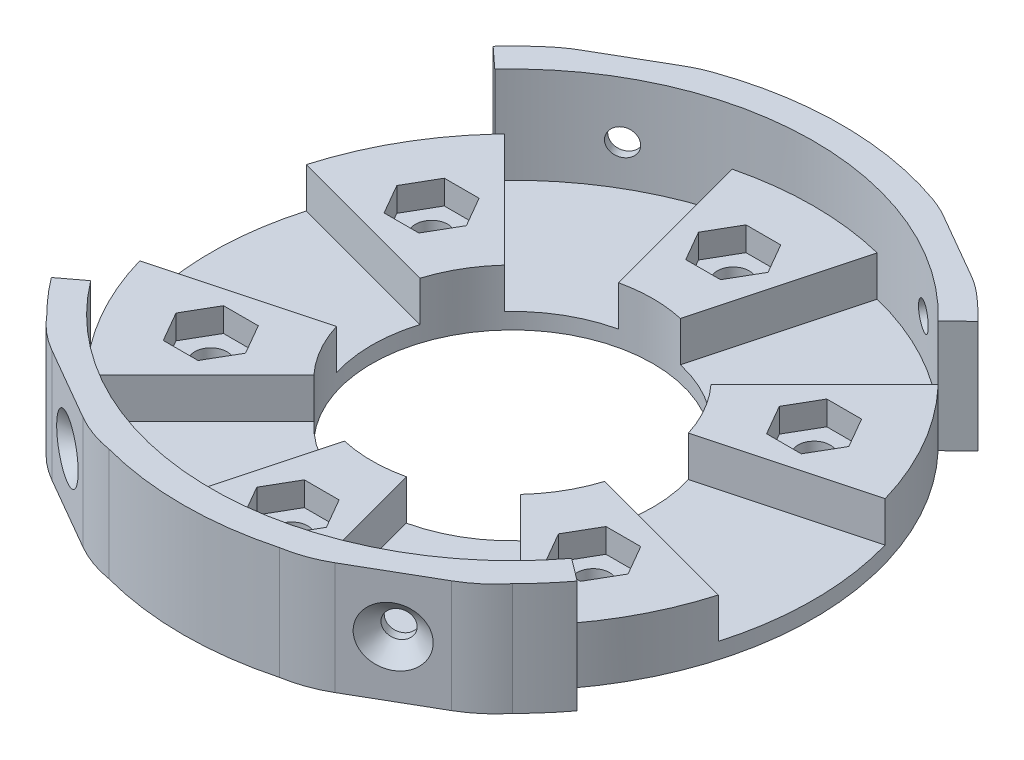
from build123d import *
from build123d.topology import SkipClean

# Parameters (mm, degrees)
BOSS_EXTRUDE2_DEPTH = 3
BOSS_EXTRUDE3_START = 2
SKETCH2_R           = 2
BOSS_EXTRUDE3_DEPTH = 2
BOSS_EXTRUDE4_START = 2
SKETCH3_R           = 37.5
SKETCH3_R_2         = 17.5
SKETCH3_R_3         = 2
BOSS_EXTRUDE4_DEPTH = 2
BOSS_EXTRUDE5_DEPTH = 14
FILLET1_R           = 15
CUT_EXTRUDE1_DEPTH  = 85
CUT_EXTRUDE2_DEPTH  = 85
CHAMFER2_SIZE       = 2


with BuildPart() as part:
    # Sketch1 → Boss-Extrude2 (new body)
    # profile 1 of 9: a face of its own
    with BuildSketch(Plane(origin=(0, 0, 0), x_dir=(1, 0, 0), z_dir=(0, 1, 0))):
        with BuildLine():
            ThreePointArc((-3.849560294, 17.071346917), (-1.936676142, 17.392506591), (0, 17.5))
            Line((0, 17.5), (0, 23.75))
            Line((0, 23.75), (-2.165063509, 23.75))
            Line((-2.165063509, 23.75), (-4.330127019, 27.5))
            Line((-4.330127019, 27.5), (-2.165063509, 31.25))
            Line((-2.165063509, 31.25), (0, 31.25))
            Line((0, 31.25), (0, 37.5))
            ThreePointArc((0, 37.5), (-4.547498174, 37.223248923), (-9.027875015, 36.397080552))
            Line((-9.027875015, 36.397080552), (-3.849560294, 17.071346917))
        make_face()
    # profile 2 of 9: a face of its own
    with BuildSketch(Plane(origin=(0, 0, 0), x_dir=(1, 0, 0), z_dir=(0, 1, 0))):
        with BuildLine():
            Line((3.849560294, 17.071346917), (9.027875015, 36.397080552))
            ThreePointArc((9.027875015, 36.397080552), (4.547498174, 37.223248923), (0, 37.5))
            Line((0, 37.5), (0, 31.25))
            Line((0, 31.25), (2.165063509, 31.25))
            Line((2.165063509, 31.25), (4.330127019, 27.5))
            Line((4.330127019, 27.5), (2.165063509, 23.75))
            Line((2.165063509, 23.75), (0, 23.75))
            Line((0, 23.75), (0, 17.5))
            ThreePointArc((0, 17.5), (1.936676142, 17.392506591), (3.849560294, 17.071346917))
        make_face()
    # profile 3 of 9: a face of its own
    with BuildSketch(Plane(origin=(0, 0, 0), x_dir=(1, 0, 0), z_dir=(0, 1, 0))):
        with BuildLine():
            Line((-36.034733889, 10.380171171), (-16.709000253, 5.201856451))
            ThreePointArc((-16.709000253, 5.201856451), (-15.155444566, 8.75), (-12.85943996, 11.869490466))
            Line((-12.85943996, 11.869490466), (-27.006858875, 26.016909381))
            ThreePointArc((-27.006858875, 26.016909381), (-32.475952642, 18.75), (-36.034733889, 10.380171171))
        make_face()
        Polygon((-21.650635095, 10), (-25.980762114, 10), (-28.145825623, 13.75), (-25.980762114, 17.5), (-21.650635095, 17.5), (-19.485571585, 13.75), align=None, mode=Mode.SUBTRACT)
    # profile 4 of 9: a face of its own
    with BuildSketch(Plane(origin=(0, 0, 0), x_dir=(1, 0, 0), z_dir=(0, 1, 0))):
        with BuildLine():
            Line((19.485571585, 13.75), (21.650635095, 17.5))
            Line((21.650635095, 17.5), (24.609026292, 17.5))
            Line((24.609026292, 17.5), (26.250883265, 25.260933771))
            Line((26.250883265, 25.260933771), (12.85943996, 11.869490466))
            ThreePointArc((12.85943996, 11.869490466), (14.094014472, 10.373464034), (15.155444566, 8.75))
            Line((15.155444566, 8.75), (20.56810334, 11.875))
            Line((20.56810334, 11.875), (19.485571585, 13.75))
        make_face()
    # profile 5 of 9: a face of its own
    with BuildSketch(Plane(origin=(0, 0, 0), x_dir=(1, 0, 0), z_dir=(0, 1, 0))):
        with BuildLine():
            Line((21.650635095, 10), (20.56810334, 11.875))
            Line((20.56810334, 11.875), (15.155444566, 8.75))
            ThreePointArc((15.155444566, 8.75), (16.030690615, 7.019042557), (16.709000253, 5.201856451))
            Line((16.709000253, 5.201856451), (36.034733889, 10.380171171))
            ThreePointArc((36.034733889, 10.380171171), (34.510028266, 14.673375519), (32.475952642, 18.75))
            Line((32.475952642, 18.75), (27.063293868, 15.625))
            Line((27.063293868, 15.625), (28.145825623, 13.75))
            Line((28.145825623, 13.75), (25.980762114, 10))
            Line((25.980762114, 10), (21.650635095, 10))
        make_face()
    # profile 6 of 9: a face of its own
    with BuildSketch(Plane(origin=(0, 0, 0), x_dir=(1, 0, 0), z_dir=(0, 1, 0))):
        with BuildLine():
            Line((26.250883265, 25.260933771), (24.609026292, 17.5))
            Line((24.609026292, 17.5), (25.980762114, 17.5))
            Line((25.980762114, 17.5), (27.063293868, 15.625))
            Line((27.063293868, 15.625), (32.475952642, 18.75))
            ThreePointArc((32.475952642, 18.75), (29.962530091, 22.549873404), (27.006858875, 26.016909381))
            Line((27.006858875, 26.016909381), (26.250883265, 25.260933771))
        make_face()
    # profile 7 of 9: a face of its own
    with BuildSketch(Plane(origin=(0, 0, 0), x_dir=(1, 0, 0), z_dir=(0, 1, 0))):
        with BuildLine():
            Line((36.034733889, -10.380171171), (16.709000253, -5.201856451))
            ThreePointArc((16.709000253, -5.201856451), (15.155444566, -8.75), (12.85943996, -11.869490466))
            Line((12.85943996, -11.869490466), (27.006858875, -26.016909381))
            ThreePointArc((27.006858875, -26.016909381), (32.475952642, -18.75), (36.034733889, -10.380171171))
        make_face()
        Polygon((21.650635095, -10), (25.980762114, -10), (28.145825623, -13.75), (25.980762114, -17.5), (21.650635095, -17.5), (19.485571585, -13.75), align=None, mode=Mode.SUBTRACT)
    # profile 8 of 9: a face of its own
    with BuildSketch(Plane(origin=(0, 0, 0), x_dir=(1, 0, 0), z_dir=(0, 1, 0))):
        with BuildLine():
            Line((9.027875015, -36.397080552), (3.849560294, -17.071346917))
            ThreePointArc((3.849560294, -17.071346917), (0, -17.5), (-3.849560294, -17.071346917))
            Line((-3.849560294, -17.071346917), (-9.027875015, -36.397080552))
            ThreePointArc((-9.027875015, -36.397080552), (0, -37.5), (9.027875015, -36.397080552))
        make_face()
        Polygon((2.165063509, -23.75), (4.330127019, -27.5), (2.165063509, -31.25), (-2.165063509, -31.25), (-4.330127019, -27.5), (-2.165063509, -23.75), align=None, mode=Mode.SUBTRACT)
    # profile 9 of 9: a face of its own
    with BuildSketch(Plane(origin=(0, 0, 0), x_dir=(1, 0, 0), z_dir=(0, 1, 0))):
        with BuildLine():
            Line((-27.006858875, -26.016909381), (-12.85943996, -11.869490466))
            ThreePointArc((-12.85943996, -11.869490466), (-15.155444566, -8.75), (-16.709000253, -5.201856451))
            Line((-16.709000253, -5.201856451), (-36.034733889, -10.380171171))
            ThreePointArc((-36.034733889, -10.380171171), (-32.475952642, -18.75), (-27.006858875, -26.016909381))
        make_face()
        Polygon((-19.485571585, -13.75), (-21.650635095, -17.5), (-25.980762114, -17.5), (-28.145825623, -13.75), (-25.980762114, -10), (-21.650635095, -10), align=None, mode=Mode.SUBTRACT)
    extrude(amount=BOSS_EXTRUDE2_DEPTH)

    # Sketch2 → Boss-Extrude3 (add)
    # profile 1 of 6: a face of its own
    with BuildSketch(Plane(origin=(0, 0, 0), x_dir=(-1, 0, 0), z_dir=(0, -1, 0)).offset(BOSS_EXTRUDE3_START)):
        with BuildLine():
            ThreePointArc((12.85943996, 11.869490466), (15.155444566, 8.75), (16.709000253, 5.201856451))
            Line((16.709000253, 5.201856451), (36.034733889, 10.380171171))
            ThreePointArc((36.034733889, 10.380171171), (32.475952642, 18.75), (27.006858875, 26.016909381))
            Line((27.006858875, 26.016909381), (12.85943996, 11.869490466))
        make_face()
        with Locations(Location((23.815698604, 13.75, 0), (0, 0, 90))):
            Circle(SKETCH2_R, mode=Mode.SUBTRACT)
    # profile 2 of 6: a face of its own
    with BuildSketch(Plane(origin=(0, 0, 0), x_dir=(-1, 0, 0), z_dir=(0, -1, 0)).offset(BOSS_EXTRUDE3_START)):
        with BuildLine():
            Line((36.034733889, -10.380171171), (16.709000253, -5.201856451))
            ThreePointArc((16.709000253, -5.201856451), (15.155444566, -8.75), (12.85943996, -11.869490466))
            Line((12.85943996, -11.869490466), (27.006858875, -26.016909381))
            ThreePointArc((27.006858875, -26.016909381), (32.475952642, -18.75), (36.034733889, -10.380171171))
        make_face()
        with Locations(Location((23.815698604, -13.75, 0), (0, 0, 90))):
            Circle(SKETCH2_R, mode=Mode.SUBTRACT)
    # profile 3 of 6: a face of its own
    with BuildSketch(Plane(origin=(0, 0, 0), x_dir=(-1, 0, 0), z_dir=(0, -1, 0)).offset(BOSS_EXTRUDE3_START)):
        with BuildLine():
            ThreePointArc((-3.849560294, 17.071346917), (0, 17.5), (3.849560294, 17.071346917))
            Line((3.849560294, 17.071346917), (9.027875015, 36.397080552))
            ThreePointArc((9.027875015, 36.397080552), (0, 37.5), (-9.027875015, 36.397080552))
            Line((-9.027875015, 36.397080552), (-3.849560294, 17.071346917))
        make_face()
        with Locations(Location((0, 27.5, 0), (0, 0, 90))):
            Circle(SKETCH2_R, mode=Mode.SUBTRACT)
    # profile 4 of 6: a face of its own
    with BuildSketch(Plane(origin=(0, 0, 0), x_dir=(-1, 0, 0), z_dir=(0, -1, 0)).offset(BOSS_EXTRUDE3_START)):
        with BuildLine():
            Line((9.027875015, -36.397080552), (3.849560294, -17.071346917))
            ThreePointArc((3.849560294, -17.071346917), (0, -17.5), (-3.849560294, -17.071346917))
            Line((-3.849560294, -17.071346917), (-9.027875015, -36.397080552))
            ThreePointArc((-9.027875015, -36.397080552), (0, -37.5), (9.027875015, -36.397080552))
        make_face()
        with Locations(Location((0, -27.5, 0), (0, 0, 90))):
            Circle(SKETCH2_R, mode=Mode.SUBTRACT)
    # profile 5 of 6: a face of its own
    with BuildSketch(Plane(origin=(0, 0, 0), x_dir=(-1, 0, 0), z_dir=(0, -1, 0)).offset(BOSS_EXTRUDE3_START)):
        with BuildLine():
            ThreePointArc((-16.709000253, 5.201856451), (-15.155444566, 8.75), (-12.85943996, 11.869490466))
            Line((-12.85943996, 11.869490466), (-27.006858875, 26.016909381))
            ThreePointArc((-27.006858875, 26.016909381), (-32.475952642, 18.75), (-36.034733889, 10.380171171))
            Line((-36.034733889, 10.380171171), (-16.709000253, 5.201856451))
        make_face()
        with Locations(Location((-23.815698604, 13.75, 0), (0, 0, 90))):
            Circle(SKETCH2_R, mode=Mode.SUBTRACT)
    # profile 6 of 6: a face of its own
    with BuildSketch(Plane(origin=(0, 0, 0), x_dir=(-1, 0, 0), z_dir=(0, -1, 0)).offset(BOSS_EXTRUDE3_START)):
        with BuildLine():
            Line((-27.006858875, -26.016909381), (-12.85943996, -11.869490466))
            ThreePointArc((-12.85943996, -11.869490466), (-15.155444566, -8.75), (-16.709000253, -5.201856451))
            Line((-16.709000253, -5.201856451), (-36.034733889, -10.380171171))
            ThreePointArc((-36.034733889, -10.380171171), (-32.475952642, -18.75), (-27.006858875, -26.016909381))
        make_face()
        with Locations(Location((-23.815698604, -13.75, 0), (0, 0, 90))):
            Circle(SKETCH2_R, mode=Mode.SUBTRACT)
    extrude(amount=-BOSS_EXTRUDE3_DEPTH)

    # Sketch3 → Boss-Extrude4 (add)
    with BuildSketch(Plane(origin=(0, -2, 0), x_dir=(-1, 0, 0), z_dir=(0, -1, 0)).offset(BOSS_EXTRUDE4_START)):
        with Locations(Location((0, 0, 0), (0, 0, 90))):
            Circle(SKETCH3_R)
        with Locations(Location((0, 0, 0), (0, 0, 90))):
            Circle(SKETCH3_R_2, mode=Mode.SUBTRACT)
        with Locations(Location((0, 27.5, 0), (0, 0, 90))):
            Circle(SKETCH3_R_3, mode=Mode.SUBTRACT)
        with Locations(Location((23.815698604, 13.75, 0), (0, 0, 90))):
            Circle(SKETCH3_R_3, mode=Mode.SUBTRACT)
        with Locations(Location((23.815698604, -13.75, 0), (0, 0, 90))):
            Circle(SKETCH3_R_3, mode=Mode.SUBTRACT)
        with Locations(Location((0, -27.5, 0), (0, 0, 90))):
            Circle(SKETCH3_R_3, mode=Mode.SUBTRACT)
        with Locations(Location((-23.815698604, -13.75, 0), (0, 0, 90))):
            Circle(SKETCH3_R_3, mode=Mode.SUBTRACT)
        with Locations(Location((-23.815698604, 13.75, 0), (0, 0, 90))):
            Circle(SKETCH3_R_3, mode=Mode.SUBTRACT)
    extrude(amount=-BOSS_EXTRUDE4_DEPTH)

    # Sketch4 → Boss-Extrude5 (add)
    with SkipClean():  # the faces are left unmerged after this step: merging them gives an invalid solid
        with BuildSketch(Plane(origin=(0, -4, 0), x_dir=(-1, 0, 0), z_dir=(0, -1, 0))):
            with BuildLine():
                Line((32.740350171, -24.679332865), (29.94544223, -22.572560548))
                ThreePointArc((29.94544223, -22.572560548), (0, -37.5), (-29.94544223, -22.572560548))
                Line((-29.94544223, -22.572560548), (-32.740350171, -24.679332865))
                ThreePointArc((-32.740350171, -24.679332865), (-30.941073026, -26.900743484), (-28.991378029, -28.991378029))
                Line((-28.991378029, -28.991378029), (-29.69848481, -29.69848481))
                Line((-29.69848481, -29.69848481), (-10.870399894, -40.568884704))
                Line((-10.870399894, -40.568884704), (-10.611580849, -39.602958878))
                ThreePointArc((-10.611580849, -39.602958878), (0, -41), (10.611580849, -39.602958878))
                Line((10.611580849, -39.602958878), (10.870399894, -40.568884704))
                Line((10.870399894, -40.568884704), (29.69848481, -29.69848481))
                Line((29.69848481, -29.69848481), (28.991378029, -28.991378029))
                ThreePointArc((28.991378029, -28.991378029), (30.941073026, -26.900743484), (32.740350171, -24.679332865))
            make_face()
            with BuildLine():
                ThreePointArc((-27.155360006, 25.861871992), (0.320295639, 37.498632118), (27.593165519, 25.394235894))
                Line((27.593165519, 25.394235894), (30.168527634, 27.764364578))
                ThreePointArc((30.168527634, 27.764364578), (27.881377359, 30.060419101), (25.420023663, 32.168655505))
                Line((25.420023663, 32.168655505), (15.148861042, 38.098714009))
                ThreePointArc((15.148861042, 38.098714009), (0, 41), (-15.148861042, 38.098714009))
                Line((-15.148861042, 38.098714009), (-25.420023663, 32.168655505))
                ThreePointArc((-25.420023663, 32.168655505), (-27.62360777, 30.297463487), (-29.689860274, 28.275646711))
                Line((-29.689860274, 28.275646711), (-27.155360006, 25.861871992))
            make_face()
        extrude(amount=-BOSS_EXTRUDE5_DEPTH)

    # Fillet1
    # the kernel refuses this fillet: 15 mm, written as the material it takes off along each edge
    with BuildSketch(Plane(origin=(29.69848481, -17.886373995, 29.69848481), x_dir=(-0.707106781186544, 0, -0.7071067811865511), z_dir=(0, 1, 0)), Plane(origin=(-10.870399894, -17.886373995, 40.568884704), x_dir=(0.2588190451024837, 0, -0.9659258262890783), z_dir=(0, 1, 0))) as fillet1_piece_1:
        with BuildLine():
            CenterArc((15.926510617, 1.482997233), FILLET1_R, 165, 20.67390123)
            Line((1.437623223, 5.36528291), (0, 0))
            Line((0, 0), (1, 0))
        make_face()
    extrude(amount=41.772747989, mode=Mode.SUBTRACT)
    with BuildSketch(Plane(origin=(10.870399894, -17.886373995, 40.568884704), x_dir=(0.8660254037843682, 0, -0.5000000000001218), z_dir=(0, 1, 0)), Plane(origin=(-29.69848481, -17.886373995, 29.69848481), x_dir=(0.8660254037844383, 0, 0.5000000000000004), z_dir=(0, 1, 0))) as fillet1_piece_2:
        with BuildLine():
            CenterArc((5.554549598, 15), FILLET1_R, 249.32609877, 20.67390123)
            Line((0.258819045, 0.965925826), (0, 0))
            Line((0, 0), (5.554549598, 0))
        make_face()
    extrude(amount=41.772747989, mode=Mode.SUBTRACT)
    with BuildSketch(Plane(origin=(15.148861042, -7.814239506, -38.098714009), x_dir=(-0.93595071337287, 0, -0.3521310297841073), z_dir=(0, 1, 0)), Plane(origin=(-25.420023663, -7.814239506, -32.168655505), x_dir=(-0.7729297739403449, 0, 0.6344915795788999), z_dir=(0, 1, 0))) as fillet1_piece_3:
        with BuildLine():
            CenterArc((1.246605107, 14.997403388), FILLET1_R, 260.617713932, 10.448395516)
            Line((-1.198708985, 0.198064248), (0, 0))
            ThreePointArc((0, 0), (0.762847901, -0.007097406), (1.525695802, 0))
        make_face()
    extrude(amount=21.628479012, mode=Mode.SUBTRACT)
    with BuildSketch(Plane(origin=(25.420023663, -7.814239506, -32.168655505), x_dir=(-0.8660254037844413, 0, -0.4999999999999956), z_dir=(0, 1, 0)), Plane(origin=(-15.148861042, -7.814239506, -38.098714009), x_dir=(-0.8660254037843654, 0, 0.5000000000001268), z_dir=(0, 1, 0))) as fillet1_piece_4:
        with BuildLine():
            CenterArc((1.214962006, 15), FILLET1_R, 259.551604484, 10.448395516)
            ThreePointArc((-1.505285974, 0.248720363), (-0.753800013, 0.11735772), (0, 0))
            Line((0, 0), (1.214962006, 0))
        make_face()
    extrude(amount=21.628479012, mode=Mode.SUBTRACT)

    # Sketch6 → Cut-Extrude1 (cut)
    with BuildSketch(Plane(origin=(20.284442352, 0, 35.133684757), x_dir=(0.8660254037843756, 0, -0.5000000000001092), z_dir=(0.5000000000001092, 0, 0.8660254037843756))):
        with BuildLine():
            Line((1.65, 3), (0, 3))
            Line((0, 3), (0, 1.35))
            ThreePointArc((0, 1.35), (1.166726189, 1.833273811), (1.65, 3))
        make_face()
        with BuildLine():
            Line((0, 1.35), (0, 3))
            Line((0, 3), (-1.65, 3))
            ThreePointArc((-1.65, 3), (-1.166726189, 1.833273811), (0, 1.35))
        make_face()
        with BuildLine():
            Line((0, 4.65), (0, 3))
            Line((0, 3), (1.65, 3))
            ThreePointArc((1.65, 3), (1.166726189, 4.166726189), (0, 4.65))
        make_face()
        with BuildLine():
            Line((-1.65, 3), (0, 3))
            Line((0, 3), (0, 4.65))
            ThreePointArc((0, 4.65), (-1.166726189, 4.166726189), (-1.65, 3))
        make_face()
    extrude(amount=-CUT_EXTRUDE1_DEPTH, mode=Mode.SUBTRACT)

    # Sketch7 → Cut-Extrude2 (cut)
    with BuildSketch(Plane(origin=(-20.284442352, 0, 35.133684757), x_dir=(0.8660254037845003, 0, 0.4999999999998932), z_dir=(-0.49999999999989325, 0, 0.8660254037845004))):
        with BuildLine():
            Line((1.65, 3), (0, 3))
            Line((0, 3), (0, 1.35))
            ThreePointArc((0, 1.35), (1.166726189, 1.833273811), (1.65, 3))
        make_face()
        with BuildLine():
            Line((0, 1.35), (0, 3))
            Line((0, 3), (-1.65, 3))
            ThreePointArc((-1.65, 3), (-1.166726189, 1.833273811), (0, 1.35))
        make_face()
        with BuildLine():
            Line((-1.65, 3), (0, 3))
            Line((0, 3), (0, 4.65))
            ThreePointArc((0, 4.65), (-1.166726189, 4.166726189), (-1.65, 3))
        make_face()
        with BuildLine():
            Line((0, 4.65), (0, 3))
            Line((0, 3), (1.65, 3))
            ThreePointArc((1.65, 3), (1.166726189, 4.166726189), (0, 4.65))
        make_face()
    extrude(amount=-CUT_EXTRUDE2_DEPTH, mode=Mode.SUBTRACT)

    # Chamfer2
    chamfer2_edges = [part.edges().sort_by_distance(p)[0] for p in [
        (-20.284442352, 1.35, -35.133684757),
        (20.284442352, 1.35, 35.133684757),
        (18.855500436, 3, -35.958684757),
        (-21.713384268, 3, 34.308684757),
    ]]
    chamfer(chamfer2_edges, length=CHAMFER2_SIZE)


solid = part.part
